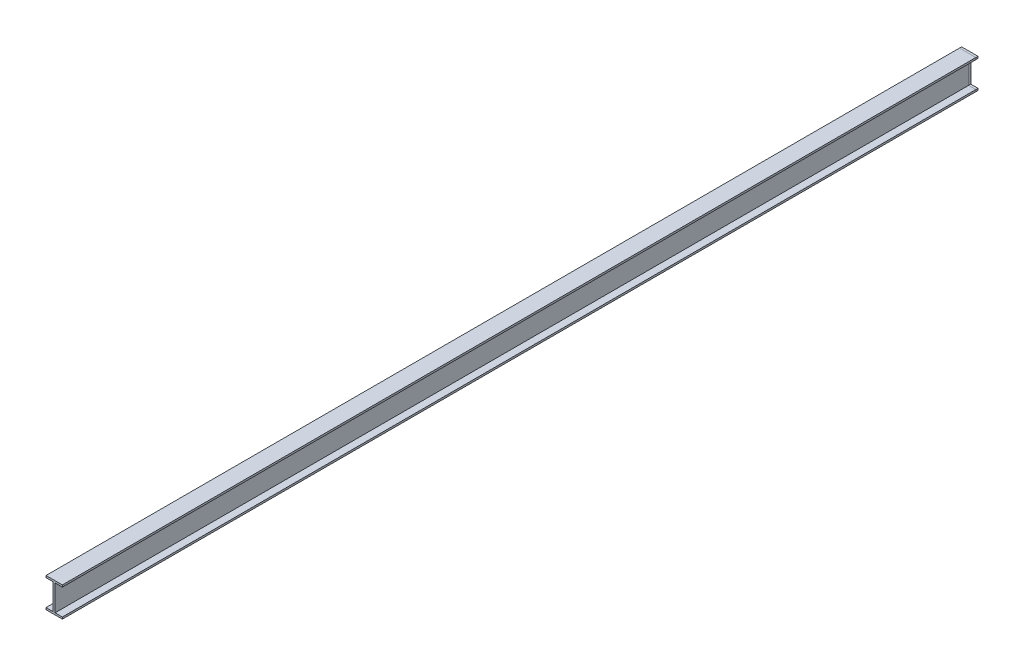
from build123d import *

# Parameters (mm, degrees)
BOSS_EXTRUDE1_DEPTH = 5486.4


with BuildPart() as part:
    # Sketch2 → Boss-Extrude1 (new body)
    with BuildSketch(Plane.XY):
        Polygon((-49.022, 11.43), (-49.022, 0), (49.022, 0), (49.022, 11.43), (5.715, 11.43), (5.715, 166.37), (49.022, 166.37), (49.022, 177.8), (-49.022, 177.8), (-49.022, 166.37), (-5.715, 166.37), (-5.715, 11.43), align=None)
    extrude(amount=BOSS_EXTRUDE1_DEPTH)


solid = part.part
